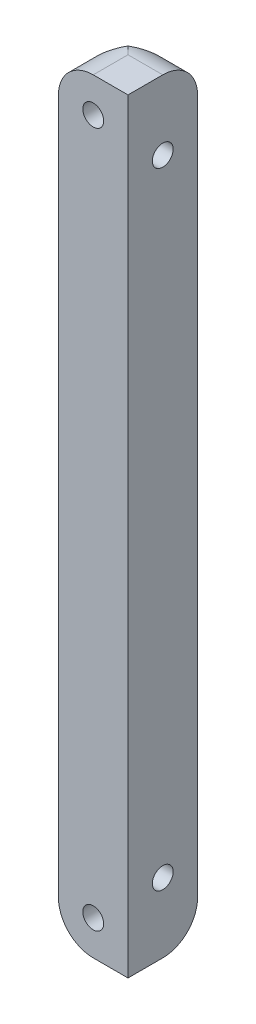
from build123d import *

# Parameters (mm, degrees)
SKETCH1_W           = 12.7
SKETCH1_H           = 139.7
BOSS_EXTRUDE1_DEPTH = 12.7
CHAMFER1_SIZE       = 9.525
SKETCH2_R           = 1.905
CUT_EXTRUDE1_DEPTH  = 141.849813631
SKETCH3_R           = 1.905
CUT_EXTRUDE2_DEPTH  = 141.849813631
FILLET1_R           = 6.35


with BuildPart() as part:
    # Sketch1 → Boss-Extrude1 (new body)
    with BuildSketch(Plane.XY):
        with Locations((6.35, 69.85)):
            Rectangle(SKETCH1_W, SKETCH1_H)
    extrude(amount=BOSS_EXTRUDE1_DEPTH)

    # Chamfer1
    chamfer1_edges = [part.edges().sort_by_distance(p)[0] for p in [
        (0, 69.85, 0),
    ]]
    chamfer(chamfer1_edges, length=CHAMFER1_SIZE)

    # Sketch2 → Cut-Extrude1 (cut, through all)
    with BuildSketch(Plane.XY.offset(12.7)):
        with Locations((6.35, 133.35)):
            Circle(SKETCH2_R)
        with Locations((6.35, 6.35)):
            Circle(SKETCH2_R)
    extrude(amount=-CUT_EXTRUDE1_DEPTH, mode=Mode.SUBTRACT)

    # Sketch3 → Cut-Extrude2 (cut, through all)
    with BuildSketch(Plane(origin=(12.7, 0, 0), x_dir=(0, 0, -1), z_dir=(1, 0, 0))):
        with Locations((-6.35, 127)):
            Circle(SKETCH3_R)
        with Locations((-6.35, 12.7)):
            Circle(SKETCH3_R)
    extrude(amount=-CUT_EXTRUDE2_DEPTH, mode=Mode.SUBTRACT)

    # Fillet1
    # the kernel refuses this fillet: 6.35 mm, written as the material it takes off along each edge
    with BuildSketch(Plane(origin=(28.575, 139.7, 0), x_dir=(0, -1, 0), z_dir=(-1, 0, 0)), Plane(origin=(0, 139.7, -6.35), x_dir=(0, -1, 0), z_dir=(0, 0, 1)), Plane(origin=(0, 0, -6.35), x_dir=(1, 0, 0), z_dir=(0, 0, 1))) as fillet1_piece_1:
        with BuildLine():
            CenterArc((FILLET1_R, FILLET1_R), FILLET1_R, 180, 90)
            Line((0, FILLET1_R), (0, 0))
            Line((0, 0), (FILLET1_R, 0))
        make_face()
    extrude(amount=34.925, mode=Mode.SUBTRACT)
    with BuildSketch(Plane(origin=(-6.35, 0, 0), x_dir=(0, 0, 1), z_dir=(1, 0, 0))) as fillet1_piece_2:
        with BuildLine():
            CenterArc((FILLET1_R, -FILLET1_R), FILLET1_R, 90, 90)
            Line((0, -FILLET1_R), (0, 0))
            Line((0, 0), (FILLET1_R, 0))
        make_face()
    extrude(amount=34.925, mode=Mode.SUBTRACT)


solid = part.part
